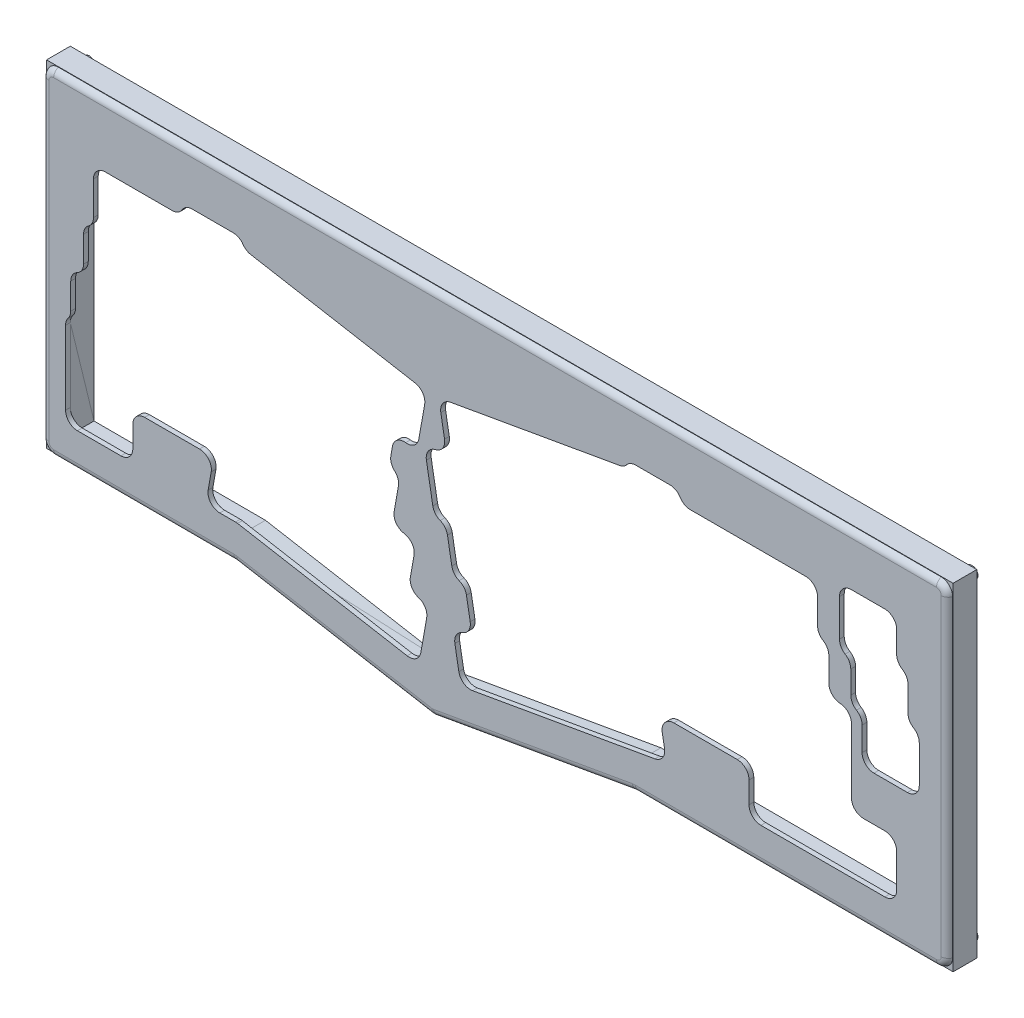
from build123d import *

# Parameters (mm, degrees)
RESSALTO_EXTRUS_O1_OUTLINE_W    = 385.763002014
RESSALTO_EXTRUS_O1_OUTLINE_H    = 172.784175795
RESSALTO_EXTRUS_O1_OUTLINE_W_2  = 13.999553143
RESSALTO_EXTRUS_O1_OUTLINE_H_2  = 14.000893144
RESSALTO_EXTRUS_O1_OUTLINE_W_3  = 13.999543143
RESSALTO_EXTRUS_O1_OUTLINE_H_3  = 14.000703143
RESSALTO_EXTRUS_O1_OUTLINE_W_4  = 13.998003143
RESSALTO_EXTRUS_O1_OUTLINE_W_5  = 14.000003143
RESSALTO_EXTRUS_O1_OUTLINE_W_6  = 14.000003144
RESSALTO_EXTRUS_O1_OUTLINE_W_7  = 13.999503143
RESSALTO_EXTRUS_O1_OUTLINE_H_4  = 13.999303143
RESSALTO_EXTRUS_O1_OUTLINE_H_5  = 13.999103143
RESSALTO_EXTRUS_O1_OUTLINE_W_8  = 13.999303144
RESSALTO_EXTRUS_O1_OUTLINE_W_9  = 13.999303143
RESSALTO_EXTRUS_O1_OUTLINE_W_10 = 13.999403143
RESSALTO_EXTRUS_O1_OUTLINE_H_6  = 13.999003143
RESSALTO_EXTRUS_O1_OUTLINE_H_7  = 14.000003143
RESSALTO_EXTRUS_O1_OUTLINE_W_11 = 14.001003144
RESSALTO_EXTRUS_O1_OUTLINE_W_12 = 13.999003143
RESSALTO_EXTRUS_O1_OUTLINE_H_8  = 14.000003144
RESSALTO_EXTRUS_O1_OUTLINE_W_13 = 13.999003144
RESSALTO_EXTRUS_O1_DEPTH        = 3
CORTE_EXTRUS_O1_DEPTH           = 3
RESSALTO_EXTRUS_O2_DEPTH        = 10
RESSALTO_EXTRUS_O3_DEPTH        = 2
RESSALTO_EXTRUS_O3_2_DEPTH      = 2
RESSALTO_EXTRUS_O4_DEPTH        = 12
RESSALTO_EXTRUS_O5_DEPTH        = 2
FILETE1_R                       = 5
FILETE2_R                       = 5
FILETE3_R                       = 5
FILETE4_R                       = 5
FILETE5_R                       = 5
FILETE6_R                       = 5
FILETE7_R                       = 5
FILETE8_R                       = 5
RESSALTO_EXTRUS_O6_DEPTH        = 2
FILETE9_R                       = 5
FILETE10_R                      = 5
FILETE11_R                      = 5
FILETE12_R                      = 3
CORTE_EXTRUS_O2_DEPTH           = 3
ESBO_O9_R                       = 2.5
RESSALTO_EXTRUS_O7_DEPTH        = 3


with BuildPart() as part:
    # Ressalto-extrusão1: read off the stored shape, not the designer's step
    # Ressalto-extrusão1 outline → Ressalto-extrusão1 (new body)
    with BuildSketch(Plane.XY):
        with Locations((-32.928151592, -125.295959232)):
            Rectangle(RESSALTO_EXTRUS_O1_OUTLINE_W, RESSALTO_EXTRUS_O1_OUTLINE_H)
        with Locations((-216.285310061, -202.161652991)):
            Rectangle(RESSALTO_EXTRUS_O1_OUTLINE_W_2, RESSALTO_EXTRUS_O1_OUTLINE_H_2, mode=Mode.SUBTRACT)
        with Locations((-211.522803992, -143.677644859)):
            Rectangle(RESSALTO_EXTRUS_O1_OUTLINE_W_3, RESSALTO_EXTRUS_O1_OUTLINE_H_3, mode=Mode.SUBTRACT)
        Polygon((-142.042718391, -152.663796877), (-155.830021487, -150.233196332), (-153.399320941, -136.447293236), (-139.610717845, -138.877993782), align=None, mode=Mode.SUBTRACT)
        Polygon((-124.664714489, -136.385193222), (-138.451817585, -133.954192677), (-136.020817039, -120.166989581), (-122.233713943, -122.597990127), align=None, mode=Mode.SUBTRACT)
        Polygon((-128.757115408, -141.024994264), (-127.058115027, -141.324094331), (-126.888414988, -140.359294115), (-123.637714259, -140.932494243), (-123.808714297, -141.89739446), (-122.109713916, -142.197594527), (-122.88671409, -146.599195516), (-121.384713753, -146.865195575), (-120.56871357, -142.234994536), (-106.779710474, -144.666995082), (-107.595710657, -149.295796121), (-106.09571032, -149.560396181), (-105.317710145, -145.157795192), (-103.620709764, -145.457995259), (-103.449709726, -144.492095043), (-100.199708996, -145.065295171), (-100.369709034, -146.030195388), (-98.671708653, -146.330395455), (-99.760708898, -152.503996841), (-98.947708715, -152.648596874), (-99.433708824, -155.404897493), (-100.245709006, -155.262697461), (-100.807709133, -158.443398175), (-102.506709514, -158.143198108), (-102.66570955, -159.049798311), (-105.914710279, -158.476498182), (-105.756710244, -157.570897979), (-107.453710625, -157.272097912), (-106.893710499, -154.090097198), (-108.394710836, -153.825497138), (-109.210711019, -158.452898177), (-122.999714115, -156.022197631), (-122.182713932, -151.394896592), (-123.684714269, -151.130296533), (-124.245714395, -154.310597247), (-125.944414777, -154.01039718), (-126.104614812, -154.916997383), (-129.353715542, -154.343697255), (-129.193815506, -153.437097051), (-130.893215888, -153.137896984), (-130.332315762, -149.95729627), (-131.144015944, -149.814096237), (-130.658915835, -147.056795618), (-129.845815652, -147.199995651), align=None, mode=Mode.SUBTRACT)
        Polygon((-81.071704701, -163.415399291), (-94.858707797, -160.984398746), (-92.426707251, -147.19719565), (-78.639704155, -149.628196196), align=None, mode=Mode.SUBTRACT)
        Polygon((-25.135692142, -144.336495008), (-25.293692178, -143.430894804), (-22.044691448, -142.857594676), (-21.884691412, -143.763194879), (-20.185691031, -143.464094812), (-19.624690905, -146.644695526), (-18.813690723, -146.501495494), (-18.326690613, -149.258796113), (-19.139690796, -149.401996145), (-18.049690551, -155.576997531), (-19.748690933, -155.876197599), (-19.579690895, -156.842097815), (-22.828691624, -157.413997944), (-22.999691663, -156.449497727), (-24.698692044, -156.748297794), (-25.474692218, -152.346996806), (-26.976692556, -152.611596866), (-26.160692372, -157.240397905), (-39.946695468, -159.671398451), (-40.763695651, -155.042197411), (-42.264695988, -155.306797471), (-41.488695814, -159.709798459), (-43.187696195, -160.008998527), (-43.016696157, -160.974898743), (-46.267696887, -161.548198872), (-46.436696925, -160.582298655), (-48.136697307, -160.881098722), (-49.224697551, -154.707397336), (-50.036697733, -154.850697368), (-50.524697843, -152.091996749), (-49.71169766, -151.950096717), (-50.272697786, -148.768096003), (-48.572697404, -148.469295936), (-48.73269744, -147.563695732), (-45.483696711, -146.990395603), (-45.323696675, -147.895995807), (-43.624696294, -147.59689574), (-43.063696168, -150.777496454), (-41.56169583, -150.512896394), (-42.377696014, -145.884095355), (-28.591692918, -143.453094809), (-27.775692735, -148.081895849), (-26.273692398, -147.815895789), (-26.834692524, -144.635295075), align=None, mode=Mode.SUBTRACT)
        Polygon((-105.903710277, -139.693893965), (-119.690713372, -137.262893419), (-117.259712827, -123.474290324), (-103.472709731, -125.90669087), align=None, mode=Mode.SUBTRACT)
        Polygon((-87.142706064, -143.001194708), (-100.93070916, -140.570194162), (-98.499708614, -126.782991066), (-84.712705519, -129.213991612), align=None, mode=Mode.SUBTRACT)
        Polygon((-50.356697805, -141.775994433), (-52.786698351, -127.988791337), (-38.999695255, -125.557790791), (-36.569694709, -139.344993887), align=None, mode=Mode.SUBTRACT)
        with Locations((150.428347277, -202.161652991)):
            Rectangle(RESSALTO_EXTRUS_O1_OUTLINE_W_4, RESSALTO_EXTRUS_O1_OUTLINE_H_2, mode=Mode.SUBTRACT)
        Polygon((-1.019686728, -152.80739691), (-3.450687273, -139.019793814), (10.338315823, -136.589093268), (12.769316368, -150.376396364), align=None, mode=Mode.SUBTRACT)
        Polygon((-31.595693593, -138.46869369), (-34.026694139, -124.680090594), (-20.239691043, -122.249090048), (-17.808690497, -136.036293144), align=None, mode=Mode.SUBTRACT)
        Polygon((-12.83468938, -135.159992947), (-15.265689926, -121.372789852), (-1.478686831, -118.941789306), (0.952313715, -132.727992401), align=None, mode=Mode.SUBTRACT)
        with Locations((74.227330168, -143.677644859)):
            Rectangle(RESSALTO_EXTRUS_O1_OUTLINE_W_5, RESSALTO_EXTRUS_O1_OUTLINE_H_3, mode=Mode.SUBTRACT)
        with Locations((93.277334445, -143.677644859)):
            Rectangle(RESSALTO_EXTRUS_O1_OUTLINE_W_5, RESSALTO_EXTRUS_O1_OUTLINE_H_3, mode=Mode.SUBTRACT)
        with Locations((112.327338722, -143.677644859)):
            Rectangle(RESSALTO_EXTRUS_O1_OUTLINE_W_6, RESSALTO_EXTRUS_O1_OUTLINE_H_3, mode=Mode.SUBTRACT)
        with Locations((-204.570682431, -124.628340583)):
            Rectangle(RESSALTO_EXTRUS_O1_OUTLINE_W_7, RESSALTO_EXTRUS_O1_OUTLINE_H_4, mode=Mode.SUBTRACT)
        with Locations((-204.379082388, -105.578436306)):
            Rectangle(RESSALTO_EXTRUS_O1_OUTLINE_W_7, RESSALTO_EXTRUS_O1_OUTLINE_H_5, mode=Mode.SUBTRACT)
        with Locations((-178.185376506, -105.578436306)):
            Rectangle(RESSALTO_EXTRUS_O1_OUTLINE_W_8, RESSALTO_EXTRUS_O1_OUTLINE_H_5, mode=Mode.SUBTRACT)
        with Locations((-173.422875437, -124.628340583)):
            Rectangle(RESSALTO_EXTRUS_O1_OUTLINE_W_9, RESSALTO_EXTRUS_O1_OUTLINE_H_4, mode=Mode.SUBTRACT)
        Polygon((-143.424918701, -133.07789248), (-157.212221797, -130.646891934), (-154.781521251, -116.859688838), (-140.994318156, -119.290689384), align=None, mode=Mode.SUBTRACT)
        Polygon((-149.496620065, -112.662287896), (-163.28382316, -110.23088735), (-160.853222614, -96.443884254), (-147.065919519, -98.8748848), align=None, mode=Mode.SUBTRACT)
        Polygon((-130.735815852, -115.970988639), (-144.524518948, -113.539988093), (-142.093918403, -99.752884997), (-128.305215307, -102.183885543), align=None, mode=Mode.SUBTRACT)
        with Locations((-201.997831853, -86.528382029)):
            Rectangle(RESSALTO_EXTRUS_O1_OUTLINE_W_10, RESSALTO_EXTRUS_O1_OUTLINE_H_6, mode=Mode.SUBTRACT)
        with Locations((-178.185376506, -86.528382029)):
            Rectangle(RESSALTO_EXTRUS_O1_OUTLINE_W_8, RESSALTO_EXTRUS_O1_OUTLINE_H_6, mode=Mode.SUBTRACT)
        Polygon((-150.878720375, -93.075883498), (-164.666023471, -90.643882952), (-162.235422925, -76.856879857), (-148.447819829, -79.287880402), align=None, mode=Mode.SUBTRACT)
        Polygon((-132.118016163, -96.383884241), (-145.906719259, -93.952883695), (-143.474618713, -80.163880599), (-129.687415617, -82.595881145), align=None, mode=Mode.SUBTRACT)
        Polygon((-111.97671164, -119.278289381), (-125.762714736, -116.847288836), (-123.33171419, -103.05988574), (-109.544711094, -105.490886286), align=None, mode=Mode.SUBTRACT)
        Polygon((-93.214707428, -122.586690124), (-107.001710523, -120.155989578), (-104.570709978, -106.368886483), (-90.783706882, -108.799887029), align=None, mode=Mode.SUBTRACT)
        Polygon((-58.354699601, -123.842190406), (-60.785700147, -110.05488731), (-46.997697051, -107.623886765), (-44.567696505, -121.41118986), align=None, mode=Mode.SUBTRACT)
        Polygon((-39.593695388, -120.534889664), (-42.024695934, -106.747886568), (-28.237692839, -104.316886022), (-25.806692293, -118.103889118), align=None, mode=Mode.SUBTRACT)
        Polygon((-94.596707738, -102.998885726), (-108.385710834, -100.568885181), (-105.953710288, -86.779882085), (-92.165707192, -89.211882631), align=None, mode=Mode.SUBTRACT)
        Polygon((-113.35771195, -99.691884984), (-127.144915046, -97.259884438), (-124.7137145, -83.472881342), (-110.926711405, -85.903881888), align=None, mode=Mode.SUBTRACT)
        Polygon((-66.352701397, -105.90888638), (-68.783701942, -92.120883284), (-54.996698847, -89.689882738), (-52.565698301, -103.477885834), align=None, mode=Mode.SUBTRACT)
        Polygon((-47.591697184, -102.600885637), (-50.02269773, -88.813882541), (-36.235694634, -86.382881995), (-33.804694089, -100.168885091), align=None, mode=Mode.SUBTRACT)
        with Locations((-201.997831853, -67.478377751)):
            Rectangle(RESSALTO_EXTRUS_O1_OUTLINE_W_10, RESSALTO_EXTRUS_O1_OUTLINE_H_6, mode=Mode.SUBTRACT)
        with Locations((-182.947877576, -67.478377751)):
            Rectangle(RESSALTO_EXTRUS_O1_OUTLINE_W_9, RESSALTO_EXTRUS_O1_OUTLINE_H_6, mode=Mode.SUBTRACT)
        with Locations((-163.897873298, -62.715876682)):
            Rectangle(RESSALTO_EXTRUS_O1_OUTLINE_W_8, RESSALTO_EXTRUS_O1_OUTLINE_H_7, mode=Mode.SUBTRACT)
        Polygon((-138.191117526, -75.968879657), (-151.978420622, -73.536879111), (-149.547720076, -59.750876016), (-135.76051698, -62.181876562), align=None, mode=Mode.SUBTRACT)
        Polygon((-100.671709102, -82.584881143), (-114.457712197, -80.152880597), (-112.026711652, -66.366877501), (-98.237708556, -68.797878047), align=None, mode=Mode.SUBTRACT)
        Polygon((-81.90970489, -85.892881885), (-95.696707985, -83.46188134), (-93.265707439, -69.673878244), (-79.478704344, -72.10487879), align=None, mode=Mode.SUBTRACT)
        Polygon((-119.430713314, -79.2768804), (-133.21801641, -76.845879854), (-130.785615864, -63.057876758), (-116.999712768, -65.488877304), align=None, mode=Mode.SUBTRACT)
        Polygon((-60.279700033, -85.493881796), (-62.710700579, -71.7068787), (-48.924697484, -69.275878154), (-46.493696938, -83.06288125), align=None, mode=Mode.SUBTRACT)
        Polygon((-41.520695821, -82.186881053), (-43.951696367, -68.397877957), (-30.162693271, -65.966877412), (-27.731692725, -79.755880508), align=None, mode=Mode.SUBTRACT)
        Polygon((5.925314832, -131.852692205), (3.493314286, -118.064089109), (17.282317382, -115.633388563), (19.712317927, -129.420691659), align=None, mode=Mode.SUBTRACT)
        Polygon((-20.833691176, -117.226188921), (-23.264691722, -103.438885825), (-9.476688626, -101.007885279), (-7.045688081, -114.795588375), align=None, mode=Mode.SUBTRACT)
        Polygon((-2.072686964, -113.918888178), (-4.50368751, -100.131885083), (9.283315586, -97.700884537), (11.714316132, -111.487887632), align=None, mode=Mode.SUBTRACT)
        with Locations((36.888821784, -124.628340583)):
            Rectangle(RESSALTO_EXTRUS_O1_OUTLINE_W_11, RESSALTO_EXTRUS_O1_OUTLINE_H_4, mode=Mode.SUBTRACT)
        with Locations((62.320827495, -124.628340583)):
            Rectangle(RESSALTO_EXTRUS_O1_OUTLINE_W_12, RESSALTO_EXTRUS_O1_OUTLINE_H_4, mode=Mode.SUBTRACT)
        with Locations((31.364820544, -105.578436306)):
            Rectangle(RESSALTO_EXTRUS_O1_OUTLINE_W_12, RESSALTO_EXTRUS_O1_OUTLINE_H_5, mode=Mode.SUBTRACT)
        with Locations((50.414824821, -105.578436306)):
            Rectangle(RESSALTO_EXTRUS_O1_OUTLINE_W_12, RESSALTO_EXTRUS_O1_OUTLINE_H_5, mode=Mode.SUBTRACT)
        Polygon((-28.831692972, -99.290884894), (-31.262693518, -85.504881798), (-17.474690422, -83.074881253), (-15.043689876, -96.861884348), align=None, mode=Mode.SUBTRACT)
        Polygon((-10.07068876, -95.983884151), (-12.501689306, -82.197881056), (1.28431379, -79.76688051), (3.716314336, -93.552883605), align=None, mode=Mode.SUBTRACT)
        Polygon((8.689315452, -92.676883409), (6.259314907, -78.888880313), (20.046318002, -76.458879767), (22.477318548, -90.245882863), align=None, mode=Mode.SUBTRACT)
        with Locations((36.127321613, -86.528382029)):
            Rectangle(RESSALTO_EXTRUS_O1_OUTLINE_W_6, RESSALTO_EXTRUS_O1_OUTLINE_H_6, mode=Mode.SUBTRACT)
        with Locations((55.17732589, -86.528382029)):
            Rectangle(RESSALTO_EXTRUS_O1_OUTLINE_W_6, RESSALTO_EXTRUS_O1_OUTLINE_H_6, mode=Mode.SUBTRACT)
        with Locations((93.277334445, -124.628340583)):
            Rectangle(RESSALTO_EXTRUS_O1_OUTLINE_W_5, RESSALTO_EXTRUS_O1_OUTLINE_H_4, mode=Mode.SUBTRACT)
        Polygon((74.3713302, -103.278885789), (74.3713302, -98.578884734), (88.370333343, -98.578884734), (88.370333343, -103.278885789), (89.896333686, -103.278885789), (89.896333686, -100.048885064), (91.621334073, -100.048885064), (91.621334073, -99.126884857), (94.920334814, -99.126884857), (94.920334814, -100.048885064), (96.645335201, -100.048885064), (96.645335201, -103.278885789), (97.471335386, -103.278885789), (97.471335386, -106.077886418), (96.645335201, -106.077886418), (96.645335201, -112.347987825), (94.920334814, -112.347987825), (94.920334814, -113.329088046), (91.621334073, -113.329088046), (91.621334073, -112.347987825), (89.896333686, -112.347987825), (89.896333686, -107.878886822), (88.370333343, -107.878886822), (88.370333343, -112.577987877), (74.3713302, -112.577987877), (74.3713302, -107.878886822), (72.846329857, -107.878886822), (72.846329857, -112.347987825), (71.12032947, -112.347987825), (71.12032947, -113.329088046), (67.821328729, -113.329088046), (67.821328729, -112.347987825), (66.096328342, -112.347987825), (66.096328342, -106.077886418), (65.270328156, -106.077886418), (65.270328156, -103.278885789), (66.096328342, -103.278885789), (66.096328342, -100.048885064), (67.821328729, -100.048885064), (67.821328729, -99.126884857), (71.12032947, -99.126884857), (71.12032947, -100.048885064), (72.846329857, -100.048885064), (72.846329857, -103.278885789), align=None, mode=Mode.SUBTRACT)
        with Locations((78.989831237, -86.528382029)):
            Rectangle(RESSALTO_EXTRUS_O1_OUTLINE_W_12, RESSALTO_EXTRUS_O1_OUTLINE_H_6, mode=Mode.SUBTRACT)
        with Locations((121.852340861, -100.815885236)):
            Rectangle(RESSALTO_EXTRUS_O1_OUTLINE_W_5, RESSALTO_EXTRUS_O1_OUTLINE_H_8, mode=Mode.SUBTRACT)
        Polygon((-22.759691609, -78.87788031), (-25.190692155, -65.090877215), (-11.403689059, -62.659876669), (-8.972688513, -76.446879765), align=None, mode=Mode.SUBTRACT)
        Polygon((-3.997687396, -75.570879568), (-6.429687942, -61.781876472), (7.357315153, -59.350875926), (9.789315699, -73.139879022), align=None, mode=Mode.SUBTRACT)
        with Locations((21.839818405, -62.715876682)):
            Rectangle(RESSALTO_EXTRUS_O1_OUTLINE_W_13, RESSALTO_EXTRUS_O1_OUTLINE_H_7, mode=Mode.SUBTRACT)
        with Locations((40.889822682, -67.478377751)):
            Rectangle(RESSALTO_EXTRUS_O1_OUTLINE_W_12, RESSALTO_EXTRUS_O1_OUTLINE_H_6, mode=Mode.SUBTRACT)
        with Locations((59.93982696, -67.478377751)):
            Rectangle(RESSALTO_EXTRUS_O1_OUTLINE_W_12, RESSALTO_EXTRUS_O1_OUTLINE_H_6, mode=Mode.SUBTRACT)
        with Locations((78.989831237, -67.478377751)):
            Rectangle(RESSALTO_EXTRUS_O1_OUTLINE_W_12, RESSALTO_EXTRUS_O1_OUTLINE_H_6, mode=Mode.SUBTRACT)
        with Locations((117.089839791, -81.765880959)):
            Rectangle(RESSALTO_EXTRUS_O1_OUTLINE_W_12, RESSALTO_EXTRUS_O1_OUTLINE_H_8, mode=Mode.SUBTRACT)
        with Locations((112.327338722, -62.715876682)):
            Rectangle(RESSALTO_EXTRUS_O1_OUTLINE_W_6, RESSALTO_EXTRUS_O1_OUTLINE_H_7, mode=Mode.SUBTRACT)
    extrude(amount=RESSALTO_EXTRUS_O1_DEPTH)

    # Esboço2 → Corte-extrusão1 (cut)
    with BuildSketch(Plane.XY.offset(3)):
        Polygon((-225.809652599, -160.677996431), (-225.809652599, -211.68804713), (159.953349415, -211.68804713), (159.953349415, -38.903871335), (136.142342432, -38.903871335), (136.142342432, -160.677996431), (13.03442747, -160.483082346), (-71.116906176, -175.322186661), (-153.587996554, -160.784331894), (-156.132242037, -160.677996431), align=None)
    extrude(amount=-CORTE_EXTRUS_O1_DEPTH, mode=Mode.SUBTRACT)

    # Esboço8 → Corte-extrusão2 (cut)
    with BuildSketch(Plane(origin=(0, 0, 0), x_dir=(-1, 0, 0), z_dir=(0, 0, -1))):
        Polygon((-136.142342432, -38.903871335), (-136.142342432, -160.677996431), (-13.03442747, -160.483082346), (71.116906176, -175.322186661), (153.587996554, -160.784331894), (225.809652599, -160.677996431), (225.809652599, -38.903871335), align=None)
    extrude(amount=-CORTE_EXTRUS_O2_DEPTH, mode=Mode.SUBTRACT)


with BuildPart() as body_2:
    # Esboço3 → Ressalto-extrusão2 (new body)
    with BuildSketch(Plane.XY.offset(3)):
        Polygon((-235.809652599, -28.903871335), (-235.809652599, -170.663283783), (-154.469949744, -170.783044191), (-71.116610135, -185.476420258), (13.901513156, -170.484467717), (146.142342432, -170.693841748), (146.142342432, -28.903871335), align=None)
        Polygon((-225.809652599, -38.903871335), (-225.809652599, -160.677996431), (-153.587996554, -160.784331894), (-71.116906176, -175.322186661), (13.03442747, -160.483082346), (136.142342432, -160.677996431), (136.142342432, -38.903871335), align=None, mode=Mode.SUBTRACT)
    extrude(amount=RESSALTO_EXTRUS_O2_DEPTH)


with BuildPart() as body_3:
    # Esboço4 → Ressalto-extrusão3 (new body)
    with BuildSketch(Plane.XY.offset(13)):
        Polygon((-197.47303242, -155.727996431), (-225.809652599, -155.727996431), (-225.809652599, -160.677996431), (-153.587996554, -160.784331894), (-71.116906176, -175.322186661), (13.03442747, -160.483082346), (136.142342432, -160.677996431), (136.142342432, -112.865886808), (109.802339289, -112.865886808), (109.802339289, -93.815882531), (105.331335386, -93.815882531), (105.331335386, -112.578689011), (105.327336016, -112.578689011), (105.327336016, -131.627293288), (124.377340294, -131.627293288), (124.377340294, -155.727996431), (62.177328596, -155.727996431), (62.177328596, -136.677992154), (24.569950322, -136.677992154), (27.433350503, -152.91762906), (-71.117052717, -170.295841031), (-153.758270959, -155.727996431), (-166.760172206, -155.727996431), (-163.401316752, -136.677992154), (-197.47303242, -136.677992154), align=None)
    extrude(amount=RESSALTO_EXTRUS_O3_DEPTH)



with BuildPart() as body_4:
    # Esboço4 → Ressalto-extrus_o3 2 (new body)
    with BuildSketch(Plane.XY.offset(13)):
        Polygon((-225.809652599, -38.903871335), (-225.809652599, -117.628689011), (-223.618833959, -117.628689011), (-223.618833959, -98.656368673), (-218.237533424, -98.656368673), (-218.237533424, -79.527879322), (-214.047533424, -79.527879322), (-214.047533424, -55.428876179), (-175.94752487, -55.428876179), (-175.94752487, -50.66587511), (-151.848221726, -50.66587511), (-151.848221726, -54.215789955), (-72.230493514, -68.255547772), (9.790316833, -53.795283071), (9.790316833, -50.66587511), (33.889319977, -50.66587511), (33.889319977, -55.428876179), (91.039332808, -55.428876179), (91.039332808, -74.478880457), (95.799332808, -74.478880457), (95.799332808, -93.528884734), (105.04033822, -93.528884734), (105.04033822, -74.765878253), (100.27733715, -74.765878253), (100.27733715, -38.903871335), align=None)
    extrude(amount=RESSALTO_EXTRUS_O3_2_DEPTH)


with BuildPart() as body_3_1:
    add(body_3.part)

    add(body_4.part)  # Ressalto-extrusão4 merges body 4
    # Esboço5 → Ressalto-extrusão4 (add)
    with BuildSketch(Plane.XY.offset(3)):
        Polygon((-235.809652599, -28.903871335), (146.142342432, -28.903871335), (146.142342432, -170.693841748), (13.901513156, -170.484467717), (-71.116610135, -185.476420258), (-154.469949744, -170.783044191), (-235.809652599, -170.663283783), align=None)
        Polygon((-225.809652599, -38.903871335), (-225.809652599, -160.677996431), (-153.587996554, -160.784331894), (-71.116906176, -175.322186661), (13.03442747, -160.483082346), (136.142342432, -160.677996431), (136.142342432, -38.903871335), align=None, mode=Mode.SUBTRACT)
    extrude(amount=RESSALTO_EXTRUS_O4_DEPTH)

    # Esboço6 → Ressalto-extrusão5 (add)
    with BuildSketch(Plane.XY.offset(15)):
        Polygon((100.27733715, -50.66587511), (124.377340294, -50.66587511), (124.377340294, -69.715879387), (129.139341363, -69.715879387), (129.139341363, -88.765883664), (133.902342432, -88.765883664), (133.902342432, -107.340049982), (133.902342432, -112.865886808), (136.142342432, -112.865886808), (136.142342432, -38.903871335), (100.27733715, -38.903871335), align=None)
        Polygon((95.799332808, -93.528884734), (95.799332808, -94.528884734), (103.757811083, -94.528884734), (109.802339289, -94.528884734), (109.802339289, -92.815882531), (95.799332808, -92.815882531), align=None)
    extrude(amount=-RESSALTO_EXTRUS_O5_DEPTH)

    # Filete1
    # the kernel refuses this fillet: 5 mm, written as the material it adds along each edge
    with BuildSketch(Plane(origin=(109.802339289, -112.865886808, 13), x_dir=(1, 0, 0), z_dir=(0, 0, 1)), Plane(origin=(133.902342432, -112.865886808, 15), x_dir=(-1, 0, 0), z_dir=(0, 0, -1)), Plane(origin=(100.27733715, -50.66587511, 15), x_dir=(1, 0, 0), z_dir=(0, 0, -1)), Plane(origin=(124.377340294, -50.66587511, 15), x_dir=(0, -1, 0), z_dir=(0, 0, -1))) as filete1_piece_1:
        with BuildLine():
            CenterArc((FILETE1_R, FILETE1_R), FILETE1_R, 180, 90)
            Line((0, FILETE1_R), (0, 0))
            Line((0, 0), (FILETE1_R, 0))
        make_face()
    extrude(amount=2)
    # the kernel refuses this fillet: 5 mm, written as the material it takes off along each edge
    with BuildSketch(Plane(origin=(105.04033822, -74.765878253, 0.514050019), x_dir=(0, -1, 0), z_dir=(0, 0, 1))) as filete1_2_piece_1:
        with BuildLine():
            CenterArc((4.994379992, -5), FILETE1_R, 90, 87.283174324)
            Line((0, -4.763001069), (0, 0))
            Line((0, 0), (4.994379992, 0))
        make_face()
    extrude(amount=26.971899961, mode=Mode.SUBTRACT)
    with BuildSketch(Plane(origin=(109.802339289, -92.815882531, 27.485831097), x_dir=(0, -1, 0), z_dir=(0, 0, -1)), Plane(origin=(124.377340294, -69.715879387, 27.485831097), x_dir=(0, 1, 0), z_dir=(0, 0, -1))) as filete1_2_piece_2:
        with BuildLine():
            CenterArc((4.994332439, 5), FILETE1_R, 182.728297784, 87.271702216)
            Line((0, 4.762001069), (0, 0))
            Line((0, 0), (4.994332439, 0))
        make_face()
    extrude(amount=26.971662194, mode=Mode.SUBTRACT)
    with BuildSketch(Plane(origin=(129.139341363, -88.765883664, 27.485949981), x_dir=(0, 1, 0), z_dir=(0, 0, -1))) as filete1_2_piece_3:
        with BuildLine():
            CenterArc((4.994379992, 5), FILETE1_R, 182.716825676, 87.283174324)
            Line((0, 4.763001069), (0, 0))
            Line((0, 0), (4.994379992, 0))
        make_face()
    extrude(amount=26.971899961, mode=Mode.SUBTRACT)

    # Filete2
    filete2_edges = [body_3_1.edges().sort_by_distance(p)[0] for p in [
        (100.27733715, -74.765878253, 14),
        (133.902342432, -88.765883664, 14),
        (129.139341363, -69.715879387, 14),
    ]]
    fillet(filete2_edges, radius=FILETE2_R)

    # Filete3
    filete3_edges = [body_3_1.edges().sort_by_distance(p)[0] for p in [
        (105.331335386, -94.528884734, 14),
    ]]
    fillet(filete3_edges, radius=FILETE3_R)

    # Filete4
    # the kernel refuses this fillet: 5 mm, written as the material it adds along each edge
    with BuildSketch(Plane(origin=(95.799332808, -74.478880457, 13), x_dir=(0, -1, 0), z_dir=(0, 0, 1))) as filete4_piece_1:
        with BuildLine():
            CenterArc((4.994236678, -5), FILETE4_R, 90, 87.248745411)
            Line((0, -4.76), (0, 0))
            Line((0, 0), (4.994236678, 0))
        make_face()
    extrude(amount=2)
    # the kernel refuses this fillet: 5 mm, written as the material it takes off along each edge
    with BuildSketch(Plane(origin=(95.799332808, -94.528884734, 27.472607294), x_dir=(0.9999993393200708, -0.0011495039896187635, 0), z_dir=(0, 0, -1))) as filete4_2_piece_1:
        with BuildLine():
            CenterArc((4.994261772, -4.994787142), FILETE4_R, 92.616545752, 87.317592506)
            Line((-0.005734925, -4.989039622), (-0.505734594, -4.98846487))
            Line((-0.505734594, -4.98846487), (-0.49999967, 0.000574752))
            Line((-0.49999967, 0.000574752), (0.000574752, 0.49999967))
            ThreePointArc((0.000574752, 0.49999967), (4.532574336, 0.494790115), (4.743178704, 0.499478714))
            Line((4.743178704, 0.499478714), (4.766004438, 0))
        make_face()
    extrude(amount=26.945214589, mode=Mode.SUBTRACT)

    # Filete5
    # the kernel refuses this fillet: 5 mm, written as the material it adds along each edge
    with BuildSketch(Plane(origin=(27.433350503, -152.91762906, 13), x_dir=(-0.1736431219089551, 0.984808644465366, 0), z_dir=(0, 0, 1))) as filete5_piece_1:
        with BuildLine():
            CenterArc((FILETE5_R * 0.999983874627, FILETE5_R), FILETE5_R, 180.000923923, 89.999076077)
            Line((-FILETE5_R * 1.61252433508e-05, FILETE5_R * 0.999983874497), (0, 0))
            Line((0, 0), (FILETE5_R * 0.999983874627, 0))
        make_face()
    extrude(amount=2)
    with BuildSketch(Plane(origin=(62.177328596, -155.727996431, 13), x_dir=(1, 0, 0), z_dir=(0, 0, 1)), Plane(origin=(124.377340294, -155.727996431, 13), x_dir=(0, 1, 0), z_dir=(0, 0, 1)), Plane(origin=(124.377340294, -131.627293288, 13), x_dir=(-1, 0, 0), z_dir=(0, 0, 1))) as filete5_piece_2:
        with BuildLine():
            CenterArc((FILETE5_R, FILETE5_R), FILETE5_R, 180, 90)
            Line((0, FILETE5_R), (0, 0))
            Line((0, 0), (FILETE5_R, 0))
        make_face()
    extrude(amount=2)
    with BuildSketch(Plane(origin=(9.790316833, -50.66587511, 13), x_dir=(0, -1, 0), z_dir=(0, 0, 1))) as filete5_piece_3:
        with BuildLine():
            CenterArc((5, 4.636904725), FILETE5_R, 180, 68.030164464)
            Line((0, 4.636904725), (0, 0))
            Line((0, 0), (3.129407961, 0))
        make_face()
    extrude(amount=2)
    with BuildSketch(Plane(origin=(33.889319977, -50.66587511, 13), x_dir=(-1, 0, 0), z_dir=(0, 0, 1))) as filete5_piece_4:
        with BuildLine():
            CenterArc((4.994379992, 5), FILETE5_R, 182.716825676, 87.283174324)
            Line((0, 4.763001069), (0, 0))
            Line((0, 0), (4.994379992, 0))
        make_face()
    extrude(amount=2)
    with BuildSketch(Plane(origin=(91.039332808, -55.428876179, 13), x_dir=(0, -1, 0), z_dir=(0, 0, 1))) as filete5_piece_5:
        with BuildLine():
            CenterArc((FILETE5_R, -FILETE5_R), FILETE5_R, 90, 90)
            Line((0, -FILETE5_R), (0, 0))
            Line((0, 0), (FILETE5_R, 0))
        make_face()
    extrude(amount=2)
    # the kernel refuses this fillet: 5 mm, written as the material it takes off along each edge
    with BuildSketch(Plane(origin=(24.569950322, -136.677992154, -1.896842251), x_dir=(1, 0, 0), z_dir=(0, 0, 1))) as filete5_2_piece_1:
        with BuildLine():
            CenterArc((FILETE5_R * 1.19174738007, -FILETE5_R), FILETE5_R, 90, 99.999705858)
            Line((FILETE5_R * 0.206938735602, -FILETE5_R * 1.17364312191), (0, 0))
            Line((0, 0), (FILETE5_R * 1.19174738007, 0))
        make_face()
    extrude(amount=31.793684502, mode=Mode.SUBTRACT)
    with BuildSketch(Plane(origin=(62.177328596, -136.677992154, 0.5), x_dir=(0, -1, 0), z_dir=(0, 0, 1)), Plane(origin=(105.327336016, -131.627293288, 0.5), x_dir=(0, 1, 0), z_dir=(0, 0, 1))) as filete5_2_piece_2:
        with BuildLine():
            CenterArc((FILETE5_R, -FILETE5_R), FILETE5_R, 90, 90)
            Line((0, -FILETE5_R), (0, 0))
            Line((0, 0), (FILETE5_R, 0))
        make_face()
    extrude(amount=27, mode=Mode.SUBTRACT)
    with BuildSketch(Plane(origin=(91.039332808, -74.478880457, 4.192635114), x_dir=(0.9554016218394766, -0.2953095680578223, 0), z_dir=(0, 0, 1))) as filete5_2_piece_3:
        with BuildLine():
            CenterArc((3.736648461, 4.842376119), FILETE5_R, 197.17610135, 58.399051888)
            Line((-1.040359648, 3.365828278), (0, 0))
            ThreePointArc((0, 0), (1.245549487, 0.157623881), (2.491098974, 0))
        make_face()
    extrude(amount=19.614729772, mode=Mode.SUBTRACT)

    # Filete6
    # the kernel refuses this fillet: 5 mm, written as the material it adds along each edge
    with BuildSketch(Plane(origin=(-214.047533424, -55.428876179, 13), x_dir=(0, -1, 0), z_dir=(0, 0, 1))) as filete6_piece_1:
        with BuildLine():
            CenterArc((FILETE6_R, FILETE6_R), FILETE6_R, 180, 90)
            Line((0, FILETE6_R), (0, 0))
            Line((0, 0), (FILETE6_R, 0))
        make_face()
    extrude(amount=2)
    # the kernel refuses this fillet: 5 mm, written as the material it takes off along each edge
    with BuildSketch(Plane(origin=(-223.618833959, -117.628689011, 2.659394334), x_dir=(-1.0, 2.9902995637168304e-12, 0), z_dir=(0, 0, 1))) as filete6_2_piece_1:
        with BuildLine():
            CenterArc((5, -4.136242267), FILETE6_R, 124.182883546, 55.817116454)
            Line((0, -4.136242267), (0, 0))
            Line((0, 0), (2.19081864, 0))
        make_face()
    extrude(amount=22.681211333, mode=Mode.SUBTRACT)
    with BuildSketch(Plane(origin=(-218.237533424, -98.656368673, 0.5), x_dir=(-1, 0, 0), z_dir=(0, 0, 1))) as filete6_2_piece_2:
        with BuildLine():
            CenterArc((FILETE6_R, -FILETE6_R), FILETE6_R, 90, 90)
            Line((0, -FILETE6_R), (0, 0))
            Line((0, 0), (FILETE6_R, 0))
        make_face()
    extrude(amount=27, mode=Mode.SUBTRACT)
    with BuildSketch(Plane(origin=(-214.047533424, -79.527879322, 0.665115525), x_dir=(-1, 0, 0), z_dir=(0, 0, 1))) as filete6_2_piece_3:
        with BuildLine():
            CenterArc((5, -4.93395379), FILETE6_R, 99.323002477, 80.676997523)
            Line((0, -4.93395379), (0, 0))
            Line((0, 0), (4.19, 0))
        make_face()
    extrude(amount=26.669768949, mode=Mode.SUBTRACT)
    with BuildSketch(Plane(origin=(-175.94752487, -55.428876179, 0.514050019), x_dir=(-1, 0, 0), z_dir=(0, 0, 1))) as filete6_2_piece_4:
        with BuildLine():
            CenterArc((4.994379992, -5), FILETE6_R, 90, 87.283174324)
            Line((0, -4.763001069), (0, 0))
            Line((0, 0), (4.994379992, 0))
        make_face()
    extrude(amount=26.971899961, mode=Mode.SUBTRACT)
    with BuildSketch(Plane(origin=(-151.848221726, -54.215789955, 2.620125794), x_dir=(0, 1, 0), z_dir=(0, 0, 1))) as filete6_2_piece_5:
        with BuildLine():
            CenterArc((4.202999632, -4.957164538), FILETE6_R, 97.505245366, 72.494053775)
            Line((-0.721028512, -4.088863418), (0, 0))
            Line((0, 0), (3.549914845, 0))
        make_face()
    extrude(amount=22.759748412, mode=Mode.SUBTRACT)
    with BuildSketch(Plane(origin=(-72.230493514, -68.255547772, 10.79600286), x_dir=(-0.9848056288219238, 0.17366022411783077, 0), z_dir=(0, 0, 1))) as filete6_2_piece_6:
        with BuildLine():
            CenterArc((FILETE6_R * 0.176319771227, -FILETE6_R), FILETE6_R, 90, 19.999198765)
            Line((-FILETE6_R * 0.16568723122, -FILETE6_R * 0.0603025964292), (0, 0))
            Line((0, 0), (FILETE6_R * 0.176319771227, 0))
        make_face()
    extrude(amount=6.407994281, mode=Mode.SUBTRACT)
    with BuildSketch(Plane(origin=(9.790316833, -53.795283071, 7.495347897), x_dir=(-0.9848123051205467, -0.17362235939865395, 0), z_dir=(0, 0, 1))) as filete6_2_piece_7:
        with BuildLine():
            CenterArc((2.201860841, -5), FILETE6_R, 90, 40.117445692)
            ThreePointArc((-1.019921693, -1.176373802), (-0.463891038, -0.628129644), (0, 0))
            Line((0, 0), (2.201860841, 0))
        make_face()
    extrude(amount=13.009304205, mode=Mode.SUBTRACT)
    with BuildSketch(Plane(origin=(33.889319977, -55.428876179, 4.188379374), x_dir=(1, 0, 0), z_dir=(0, 0, 1))) as filete6_2_piece_8:
        with BuildLine():
            CenterArc((3.524648251, 5), FILETE6_R, 211.580761862, 58.419238138)
            ThreePointArc((-0.734865871, 2.381500535), (-0.216668692, 1.237271986), (0, 0))
            Line((0, 0), (3.524648251, 0))
        make_face()
    extrude(amount=19.623241253, mode=Mode.SUBTRACT)

    # Filete7
    filete7_edges = [body_3_1.edges().sort_by_distance(p)[0] for p in [
        (-71.117052717, -170.295841031, 14),
        (-153.758270959, -155.727996431, 14),
        (-166.760172206, -155.727996431, 14),
        (-163.401316752, -136.677992154, 14),
        (-197.47303242, -136.677992154, 14),
        (-197.47303242, -155.727996431, 14),
        (-225.809652599, -155.727996431, 14),
        (-151.848221726, -50.66587511, 14),
        (-175.94752487, -50.66587511, 14),
        (-218.237533424, -79.527879322, 14),
        (-225.809652599, -117.628689011, 14),
        (-223.618833959, -98.656368673, 14),
    ]]
    fillet(filete7_edges, radius=FILETE7_R)

    # Filete8
    filete8_edges = [body_3_1.edges().sort_by_distance(p)[0] for p in [
        (105.04033822, -92.815882531, 14),
    ]]
    fillet(filete8_edges, radius=FILETE8_R)

    # Esboço7 → Ressalto-extrusão6 (add)
    with BuildSketch(Plane.XY.offset(15)):
        Polygon((-76.975260078, -169.263166824), (-71.46876924, -170.829382532), (-58.76682849, -170.829382532), (-62.616721618, -149.065652669), (-54.453424121, -147.62625496), (-57.760060559, -128.865243478), (-62.451082227, -129.692390332), (-65.758929618, -110.932092372), (-70.4491272, -111.759093919), (-74.633836923, -88.024508287), (-65.253044419, -86.370435133), (-68.561224972, -67.608655914), (-70.547810438, -65.384239632), (-73.628656204, -68.008996331), (-77.813279086, -91.743089425), (-87.192513568, -90.089290989), (-89.623558821, -103.876547631), (-84.933497882, -104.703525084), (-88.241474651, -123.463876433), (-78.093763606, -125.253176901), (-81.400284413, -144.013532323), (-72.789169982, -145.531891587), align=None)
    extrude(amount=-RESSALTO_EXTRUS_O6_DEPTH)

    # Filete9
    # the kernel refuses this fillet: 5 mm, written as the material it adds along each edge
    with BuildSketch(Plane(origin=(-73.628656204, -68.008996331, 15), x_dir=(-0.984805628821923, 0.17366022411783538, 0), z_dir=(0, 0, -1))) as filete9_piece_1:
        with BuildLine():
            CenterArc((FILETE9_R * 0.999973952548, -FILETE9_R), FILETE9_R, 90, 89.998507572)
            Line((-FILETE9_R * 2.60471122574e-05, -FILETE9_R * 0.999973952209), (0, 0))
            Line((0, 0), (FILETE9_R * 0.999973952548, 0))
        make_face()
    extrude(amount=2)
    with BuildSketch(Plane(origin=(-76.975260078, -169.263166824, 15), x_dir=(-0.9848159684560495, 0.17360157912292568, 0), z_dir=(0, 0, -1))) as filete9_piece_2:
        with BuildLine():
            CenterArc((FILETE9_R * 0.999886239508, FILETE9_R), FILETE9_R, 180.006518367, 89.993481633)
            Line((-FILETE9_R * 0.000113754020314, FILETE9_R * 0.999886233038), (0, 0))
            Line((0, 0), (FILETE9_R * 0.999886239508, 0))
        make_face()
    extrude(amount=2)
    with BuildSketch(Plane(origin=(-59.231945586, -168.200041275, 13), x_dir=(0.9848058442545758, 0.17365900242150425, 0), z_dir=(0, 0, 1))) as filete9_piece_3:
        with BuildLine():
            CenterArc((FILETE9_R * 0.99946038265, FILETE9_R), FILETE9_R, 180.03092614, 89.96907386)
            Line((-FILETE9_R * 0.00053947167791, FILETE9_R * 0.999460237057), (0, 0))
            Line((0, 0), (FILETE9_R * 0.99946038265, 0))
        make_face()
    extrude(amount=2)
    with BuildSketch(Plane(origin=(-68.561224972, -67.608655914, 15), x_dir=(0.9848123051205461, 0.17362235939865642, 0), z_dir=(0, 0, -1))) as filete9_piece_4:
        with BuildLine():
            CenterArc((FILETE9_R * 1.00002480406, FILETE9_R), FILETE9_R, 179.998578849, 90.001421151)
            Line((FILETE9_R * 2.48043706884e-05, FILETE9_R * 1.00002480376), (0, 0))
            Line((0, 0), (FILETE9_R * 1.00002480406, 0))
        make_face()
    extrude(amount=2)
    # the kernel refuses this fillet: 5 mm, written as the material it takes off along each edge
    with BuildSketch(Plane(origin=(-87.192513568, -90.089290989, 27.5), x_dir=(-0.17364678638883171, -0.9848079983310613, 0), z_dir=(0, 0, -1)), Plane(origin=(-65.253044419, -86.370435133, 27.5), x_dir=(-0.1736467863888299, 0.9848079983310615, 0), z_dir=(0, 0, -1))) as filete9_2_piece_1:
        with BuildLine():
            CenterArc((FILETE9_R, -FILETE9_R), FILETE9_R, 90, 90)
            Line((0, -FILETE9_R), (0, 0))
            Line((0, 0), (FILETE9_R, 0))
        make_face()
    extrude(amount=27, mode=Mode.SUBTRACT)
    with BuildSketch(Plane(origin=(-89.623558821, -103.876547631, 27.485879951), x_dir=(0.9848079983310617, -0.17364678638882905, 0), z_dir=(0, 0, -1))) as filete9_2_piece_2:
        with BuildLine():
            CenterArc((5, -4.994351981), FILETE9_R, 92.723589235, 87.276410765)
            Line((0, -4.994351981), (0, 0))
            Line((0, 0), (4.762411503, 0))
        make_face()
    extrude(amount=26.971759903, mode=Mode.SUBTRACT)
    with BuildSketch(Plane(origin=(-88.241474651, -123.463876433, 27.50003101), x_dir=(0.9848079983310619, -0.17364678638882797, 0), z_dir=(0, 0, -1))) as filete9_2_piece_3:
        with BuildLine():
            CenterArc((FILETE9_R * 1.00000248076, -FILETE9_R), FILETE9_R, 90, 90.000142137)
            Line((FILETE9_R * 2.4807655699e-06, -FILETE9_R * 1.00000248076), (0, 0))
            Line((0, 0), (FILETE9_R * 1.00000248076, 0))
        make_face()
    extrude(amount=27.000062019, mode=Mode.SUBTRACT)
    with BuildSketch(Plane(origin=(-81.400284413, -144.013532323, 27.499089713), x_dir=(0.9848079983310616, -0.1736467863888303, 0), z_dir=(0, 0, -1)), Plane(origin=(-54.453424121, -147.62625496, 27.499089713), x_dir=(-0.17357506667210565, 0.9848206416550043, 0), z_dir=(0, 0, -1))) as filete9_2_piece_4:
        with BuildLine():
            CenterArc((FILETE9_R * 0.999927177028, -FILETE9_R), FILETE9_R, 90, 89.995827399)
            Line((-FILETE9_R * 7.28203198653e-05, -FILETE9_R * 0.999927174377), (0, 0))
            Line((0, 0), (FILETE9_R * 0.999927177028, 0))
        make_face()
    extrude(amount=26.998179426, mode=Mode.SUBTRACT)
    with BuildSketch(Plane(origin=(-57.760060559, -128.865243478, 27.486862973), x_dir=(-0.9848079983310621, -0.17364678638882608, 0), z_dir=(0, 0, -1))) as filete9_2_piece_5:
        with BuildLine():
            CenterArc((5.000363732, -4.994381048), FILETE9_R, 92.71657042, 87.287602181)
            Line((0.000363745, -4.994745176), (0, 0))
            Line((0, 0), (4.763387052, 0))
        make_face()
    extrude(amount=26.973725947, mode=Mode.SUBTRACT)
    with BuildSketch(Plane(origin=(-65.758929618, -110.932092372, 27.485940752), x_dir=(-0.9848079983310616, -0.17364678638882944, 0), z_dir=(0, 0, -1))) as filete9_2_piece_6:
        with BuildLine():
            CenterArc((5.000018584, -4.994357696), FILETE9_R, 92.722210677, 87.278002521)
            Line((1.8584e-05, -4.994376301), (0, 0))
            Line((0, 0), (4.762550253, 0))
        make_face()
    extrude(amount=26.971881503, mode=Mode.SUBTRACT)

    # Filete10
    filete10_edges = [body_3_1.edges().sort_by_distance(p)[0] for p in [
        (-74.633836923, -88.024508287, 14),
        (-70.4491272, -111.759093919, 14),
        (-62.451082227, -129.692390332, 14),
        (-62.616721618, -149.065652669, 14),
        (-72.789169982, -145.531891587, 14),
        (-78.093763606, -125.253176901, 14),
        (-84.933497882, -104.703525084, 14),
        (-77.813279086, -91.743089425, 14),
    ]]
    fillet(filete10_edges, radius=FILETE10_R)

    # Filete11
    filete11_edges = [body_3_1.edges().sort_by_distance(p)[0] for p in [
        (-235.809652599, -28.903871335, 9),
        (-235.809652599, -170.663283783, 9),
        (-154.469949744, -170.783044191, 9),
        (-71.116610135, -185.476420258, 9),
        (13.901513156, -170.484467717, 9),
        (146.142342432, -170.693841748, 9),
        (146.142342432, -28.903871335, 9),
    ]]
    fillet(filete11_edges, radius=FILETE11_R)

    # Filete12
    filete12_edges = [body_3_1.edges().sort_by_distance(p)[0] for p in [
        (-235.809652599, -99.787255721, 15),
        (-44.833655083, -28.903871335, 15),
        (-192.860289469, -170.726520223, 15),
        (-113.013842247, -178.090851899, 15),
        (-28.390851078, -177.942231931, 15),
        (77.738699216, -170.585539747, 15),
        (146.142342432, -99.794895212, 15),
        (-234.347788314, -169.203570288, 15),
        (-71.116612383, -185.399303457, 15),
        (144.675076366, -169.224250752, 15),
        (144.677876338, -30.368337429, 15),
        (-234.345186505, -30.368337429, 15),
        (13.903193175, -170.503845868, 15),
        (-154.471598717, -170.801738612, 15),
    ]]
    fillet(filete12_edges, radius=FILETE12_R)

    # Esboço9 → Ressalto-extrusão7 (add)
    with BuildSketch(Plane(origin=(0, 0, 3), x_dir=(-1, 0, 0), z_dir=(0, 0, -1))):
        with Locations(Location((-141.142342432, -33.903871335, 0), (0, 0, 180))):
            Circle(ESBO_O9_R)
        with Locations(Location((230.809652599, -33.903871335, 0), (0, 0, 180))):
            Circle(ESBO_O9_R)
        with Locations(Location((-141.142342432, -165.68591909, 0), (0, 0, 180))):
            Circle(ESBO_O9_R)
        with Locations(Location((230.809652599, -165.670640107, 0), (0, 0, 180))):
            Circle(ESBO_O9_R)
    extrude(amount=RESSALTO_EXTRUS_O7_DEPTH)


solid = Compound([body_2.part, body_3_1.part])
